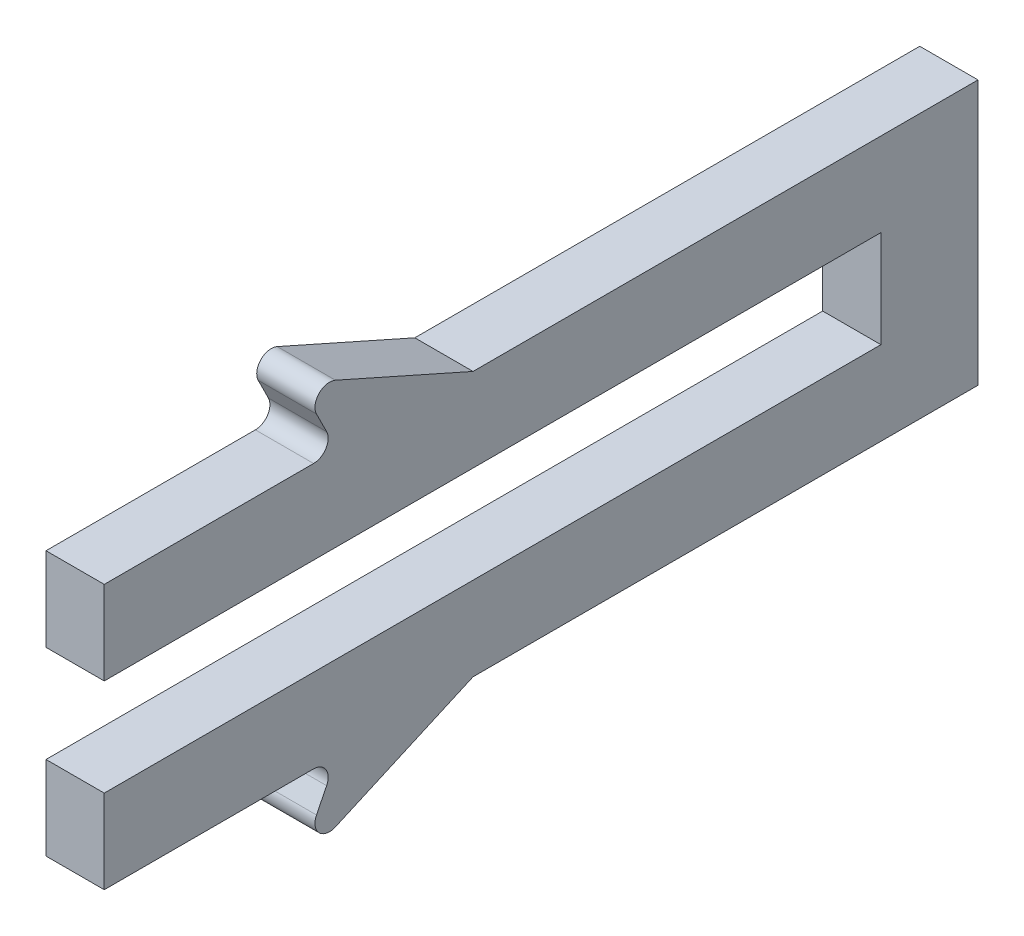
from build123d import *

# Parameters (mm, degrees)
BOSS_EXTRUDE1_DEPTH = 3
FILLET1_R           = 0.75


with BuildPart() as part:
    # Sketch2 → Boss-Extrude1 (new body)
    with BuildSketch(Plane(origin=(0, 0, 0), x_dir=(0, 0, -1), z_dir=(1, 0, 0))):
        Polygon((-20.913575794, -4.388518255), (-8.919601915, -4.388518255), (-10.913575794, -0.388518255), (-1.919601915, -4.388518255), (24.086424206, -4.388518255), (24.086424206, -18.00920791), (-1.919601915, -18.00920791), (-10.913575794, -22.00920791), (-8.919601915, -18.00920791), (-20.913575794, -18.00920791), (-20.913575794, -13.698863083), (19.086424206, -13.698863083), (19.086424206, -8.698863083), (-20.913575794, -8.698863083), align=None)
    extrude(amount=BOSS_EXTRUDE1_DEPTH)

    # Fillet1
    fillet1_edges = [part.edges().sort_by_distance(p)[0] for p in [
        (1.5, -22.00920791, 10.913575794),
        (1.5, -18.00920791, 8.919601915),
        (1.5, -4.388518255, 8.919601915),
        (1.5, -0.388518255, 10.913575794),
    ]]
    fillet(fillet1_edges, radius=FILLET1_R)


solid = part.part
